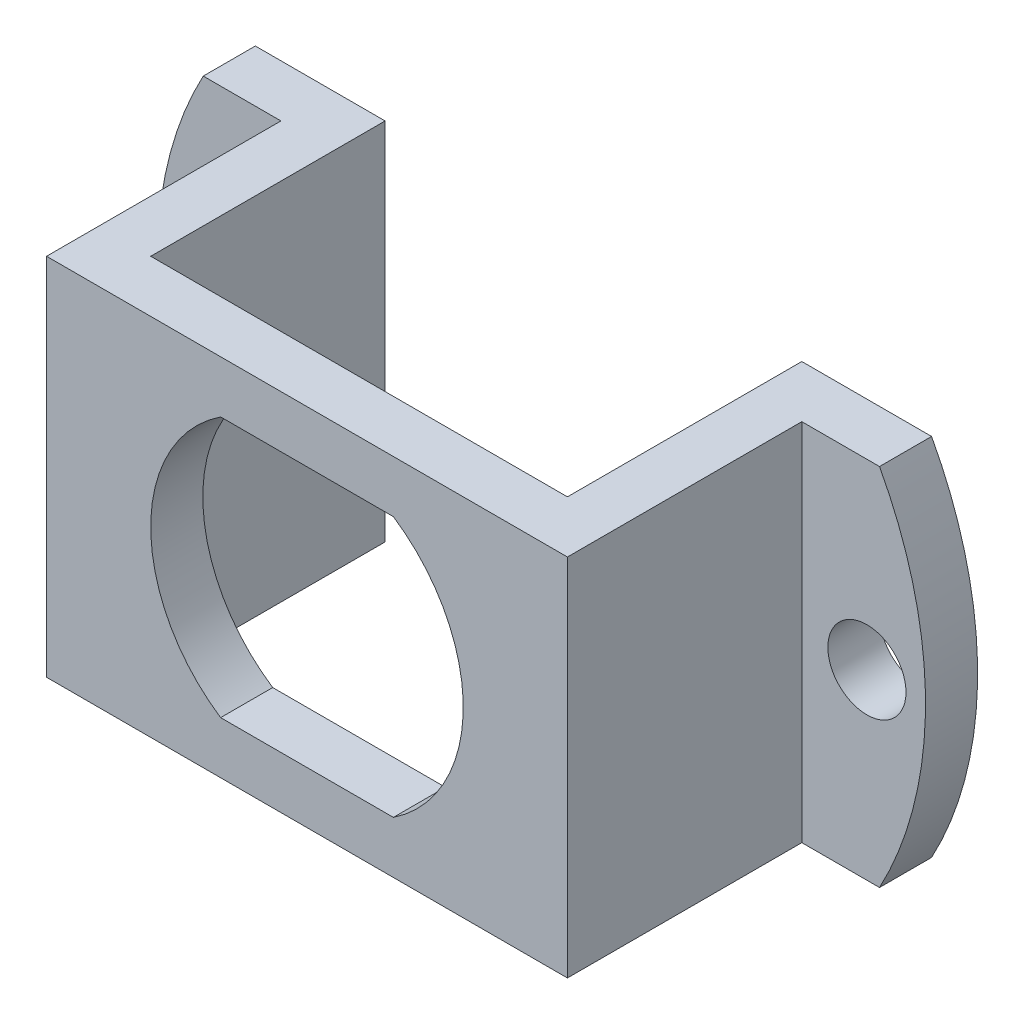
from build123d import *

# Parameters (mm, degrees)
BOSS_EXTRUDE1_DEPTH = 14
SKETCH3_R           = 1.5
CUT_EXTRUDE1_DEPTH  = 14
CUT_EXTRUDE2_START  = -2
CUT_EXTRUDE2_DEPTH  = 2


# Read off the part's stored shape, not the designer's step: Cut-Extrude2
with BuildPart() as part:
    # Sketch2 → Boss-Extrude1 (new body)
    with BuildSketch(Plane(origin=(0, 0, 0), x_dir=(1, 0, 0), z_dir=(0, 1, 0))):
        Polygon((-10, 0), (10, 0), (10, 9), (15, 9), (15, 11), (8, 11), (8, 2), (-8, 2), (-8, 11), (-15, 11), (-15, 9), (-10, 9), align=None)
    extrude(amount=BOSS_EXTRUDE1_DEPTH)

    # Sketch3 → Cut-Extrude1 (cut)
    with BuildSketch(Plane.XY):
        with Locations((-12.5, 7)):
            Circle(SKETCH3_R)
        with Locations((12.5, 7)):
            Circle(SKETCH3_R)
        with BuildLine():
            Line((-3.31662479, 2), (3.31662479, 2))
            ThreePointArc((3.31662479, 2), (6, 7), (3.31662479, 12))
            Line((3.31662479, 12), (-3.31662479, 12))
            ThreePointArc((-3.31662479, 12), (-6, 7), (-3.31662479, 2))
        make_face()
    extrude(amount=-CUT_EXTRUDE1_DEPTH, mode=Mode.SUBTRACT)

    # Cut-Extrude2 outline → Cut-Extrude2 (cut)
    with BuildSketch(Plane.XY.offset(-9).offset(CUT_EXTRUDE2_START)):
        with BuildLine():
            ThreePointArc((-12.983162173, 0), (-14.75, 7), (-12.983162173, 14))
            Line((-12.983162173, 14), (-15, 14))
            Line((-15, 14), (-15, 0))
            Line((-15, 0), (-12.983162173, 0))
        make_face()
        with BuildLine():
            Line((15, 14), (12.983162173, 14))
            ThreePointArc((12.983162173, 14), (14.75, 7), (12.983162173, 0))
            Line((12.983162173, 0), (15, 0))
            Line((15, 0), (15, 14))
        make_face()
    extrude(amount=CUT_EXTRUDE2_DEPTH, mode=Mode.SUBTRACT)


solid = part.part
